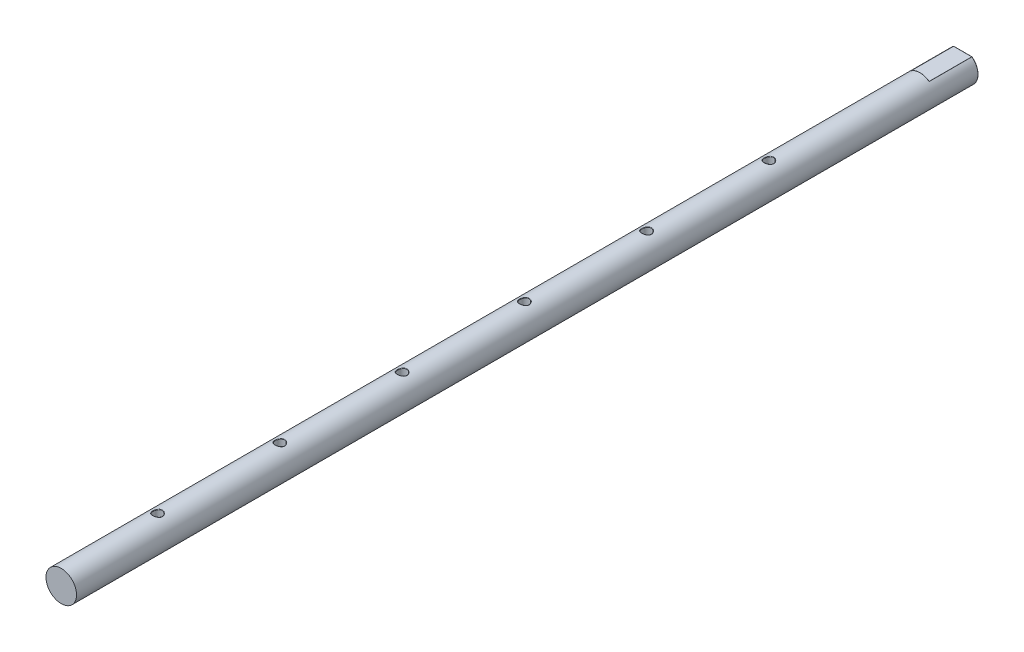
from build123d import *

# Parameters (mm, degrees)
SKETCH1_R              = 5
EXTRUDE1_DEPTH         = 295
SKETCH2_W              = 6
SKETCH2_H              = 2
CUT_EXTRUDE1_DEPTH     = 14
SKETCH3_R              = 2.5
CUT_EXTRUDE2_DEPTH     = 15
FILLET2_R              = 0.1
CUT_EXTRUDE3_START     = 6
SKETCH6_R              = 1.5
CUT_EXTRUDE3_DEPTH     = 12
FILLET3_R              = 0.1
LPATTERN1_COUNT        = 6
LPATTERN1_PITCH        = 40
FILLET3_OF_LPATTERN1_R = 0.1


with BuildPart() as part:
    # Sketch1 → Extrude1 (new body)
    with BuildSketch(Plane.XY):
        Circle(SKETCH1_R)
    extrude(amount=EXTRUDE1_DEPTH)

    # Sketch2 → Cut-Extrude1 (cut)
    with BuildSketch(Plane(origin=(0, 0, 0), x_dir=(-1, 0, 0), z_dir=(0, 0, -1))):
        with Locations((0, 5)):
            Rectangle(SKETCH2_W, SKETCH2_H)
        with Locations((0, -5)):
            Rectangle(SKETCH2_W, SKETCH2_H)
    extrude(amount=-CUT_EXTRUDE1_DEPTH, mode=Mode.SUBTRACT)

    # Sketch3 → Cut-Extrude2 (cut)
    with BuildSketch(Plane(origin=(0, 0, 0), x_dir=(-1, 0, 0), z_dir=(0, 0, -1))):
        Circle(SKETCH3_R)
    extrude(amount=-CUT_EXTRUDE2_DEPTH, mode=Mode.SUBTRACT)

    # Fillet2
    fillet2_edges = [part.edges().sort_by_distance(p)[0] for p in [
        (0, -4, 14),
    ]]
    fillet(fillet2_edges, radius=FILLET2_R)
    fillet2_2_edges = [part.edges().sort_by_distance(p)[0] for p in [
        (4.472135955, 2.236067977, 0),
        (0, -4, 0),
        (2.5, 0, 0),
        (-5, 0, 0),
        (0, 5, 14),
        (0, 4, 0),
        (3, 4, 7),
        (-3, 4, 7),
        (4.472135955, -2.236067977, 0),
    ]]
    fillet(fillet2_2_edges, radius=FILLET2_R)
    fillet2_3_edges = [part.edges().sort_by_distance(p)[0] for p in [
        (0, -5, 14),
        (3, -4, 7),
        (-3, -4, 7),
        (-2.990217545, -3.970700482, 0.029279129),
        (-2.960184269, -4.02955445, 13.970974821),
        (2.990217545, -3.970700483, 0.02927913),
        (2.960184269, -4.02955445, 13.970974821),
    ]]
    fillet(fillet2_3_edges, radius=FILLET2_R)

    # Sketch6 → Cut-Extrude3 (cut)
    with BuildSketch(Plane(origin=(0, 0, 0), x_dir=(1, 0, 0), z_dir=(0, 1, 0)).offset(CUT_EXTRUDE3_START)):
        with Locations(Location((0, -63.5, 0), (0, 0, 270))):
            Circle(SKETCH6_R)
    cut_extrude3 = extrude(amount=-CUT_EXTRUDE3_DEPTH, mode=Mode.SUBTRACT)

    # Fillet3
    fillet3_edges = [part.edges().sort_by_distance(p)[0] for p in [
        (3e-09, 4.999999993, 61.999999992),
        (3e-09, -4.999999993, 61.999999992),
    ]]
    fillet(fillet3_edges, radius=FILLET3_R)

    # LPattern1: Cut-Extrude3 ×6
    with Locations(*[(0, 0, i * LPATTERN1_PITCH) for i in range(1, LPATTERN1_COUNT)]):
        add(cut_extrude3, mode=Mode.SUBTRACT)

    # Fillet3 of LPattern1
    fillet3_of_lpattern1_edges = [part.edges().sort_by_distance(p)[0] for p in [
        (3e-09, 4.999999993, 101.999999992),
        (3e-09, -4.999999993, 101.999999992),
        (3e-09, 4.999999993, 141.999999992),
        (3e-09, -4.999999993, 141.999999992),
        (3e-09, 4.999999993, 181.999999992),
        (3e-09, -4.999999993, 181.999999992),
        (3e-09, 4.999999993, 221.999999992),
        (3e-09, -4.999999993, 221.999999992),
        (3e-09, 4.999999993, 261.999999992),
        (3e-09, -4.999999993, 261.999999992),
    ]]
    fillet(fillet3_of_lpattern1_edges, radius=FILLET3_OF_LPATTERN1_R)


solid = part.part
